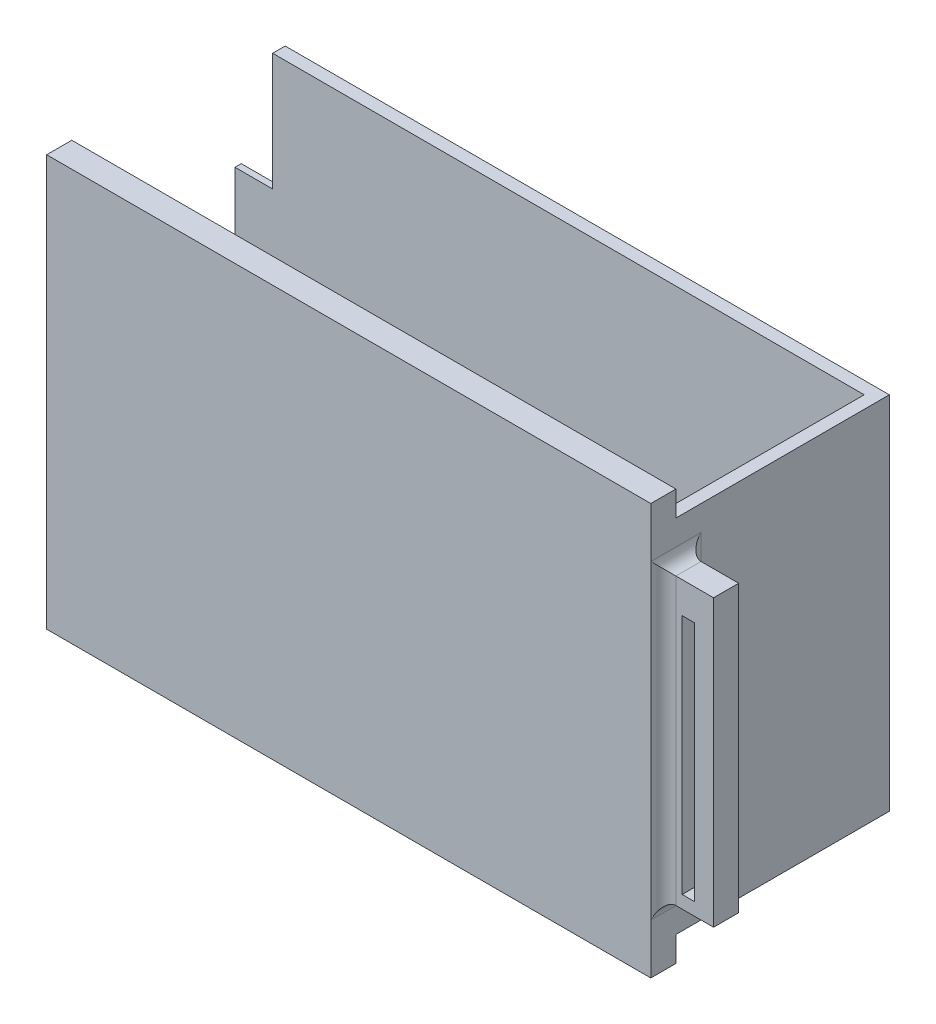
from build123d import *

# Parameters (mm, degrees)
BOSS_EXTRUDE1_DEPTH = 48.12
SKETCH3_W           = 16
SKETCH3_H           = 28.73
CUT_EXTRUDE1_DEPTH  = 47.12
SKETCH4_W           = 0.5
SKETCH4_H           = 10
BOSS_EXTRUDE2_DEPTH = 3
SKETCH5_W           = 2
SKETCH5_H           = 22.73
BOSS_EXTRUDE3_DEPTH = 4
SKETCH6_W           = 1
SKETCH6_H           = 19.230578804
CUT_EXTRUDE2_DEPTH  = 1
FILLET1_R           = 1
FILLET2_R           = 1
FILLET3_R           = 1
FILLET4_R           = 1


with BuildPart() as part:
    # Sketch2 → Boss-Extrude1 (new body)
    with BuildSketch(Plane(origin=(0, 0, 0), x_dir=(0, 0, -1), z_dir=(1, 0, 0))):
        Polygon((-1238.520696333, 790.685360665), (-1238.520696333, 788.685360665), (-1221.520696333, 788.685360665), (-1221.520696333, 759.955360665), (-1238.520696333, 759.955360665), (-1238.520696333, 757.955360665), (-1240.520696333, 757.955360665), (-1240.520696333, 790.685360665), align=None)
    extrude(amount=-BOSS_EXTRUDE1_DEPTH)

    # Sketch3 → Cut-Extrude1 (cut)
    with BuildSketch(Plane.ZY.offset(48.12)):
        with Locations((1230.520696333, 774.320360665)):
            Rectangle(SKETCH3_W, SKETCH3_H)
    extrude(amount=-CUT_EXTRUDE1_DEPTH, mode=Mode.SUBTRACT)

    # Sketch4 → Boss-Extrude2 (add)
    with BuildSketch(Plane.ZY.offset(48.12)):
        with Locations((1222.270696333, 774.320360665)):
            Rectangle(SKETCH4_W, SKETCH4_H)
    extrude(amount=BOSS_EXTRUDE2_DEPTH)

    # Sketch5 → Boss-Extrude3 (add)
    with BuildSketch(Plane(origin=(0, 0, 0), x_dir=(0, 0, -1), z_dir=(1, 0, 0))):
        with Locations((-1238.520696333, 774.320360665)):
            Rectangle(SKETCH5_W, SKETCH5_H)
    extrude(amount=BOSS_EXTRUDE3_DEPTH)

    # Sketch6 → Cut-Extrude2 (cut)
    with BuildSketch(Plane.XY.offset(1239.520696333)):
        with Locations((2, 773.582614675)):
            Rectangle(SKETCH6_W, SKETCH6_H)
    extrude(amount=-CUT_EXTRUDE2_DEPTH, mode=Mode.SUBTRACT)

    # Fillet1
    fillet1_edges = [part.edges().sort_by_distance(p)[0] for p in [
        (0, 774.320360665, 1239.520696333),
    ]]
    fillet(fillet1_edges, radius=FILLET1_R - 0.0001)  # a hair under: the kernel refuses the full size

    # Fillet2
    fillet2_edges = [part.edges().sort_by_distance(p)[0] for p in [
        (0, 774.320360665, 1237.520696333),
    ]]
    fillet(fillet2_edges, radius=FILLET2_R)

    # Fillet3
    fillet3_edges = [part.edges().sort_by_distance(p)[0] for p in [
        (0, 785.685360665, 1238.520646333),
    ]]
    fillet(fillet3_edges, radius=FILLET3_R)

    # Fillet4
    fillet4_edges = [part.edges().sort_by_distance(p)[0] for p in [
        (0, 762.955360665, 1238.520646333),
    ]]
    fillet(fillet4_edges, radius=FILLET4_R)


solid = part.part
